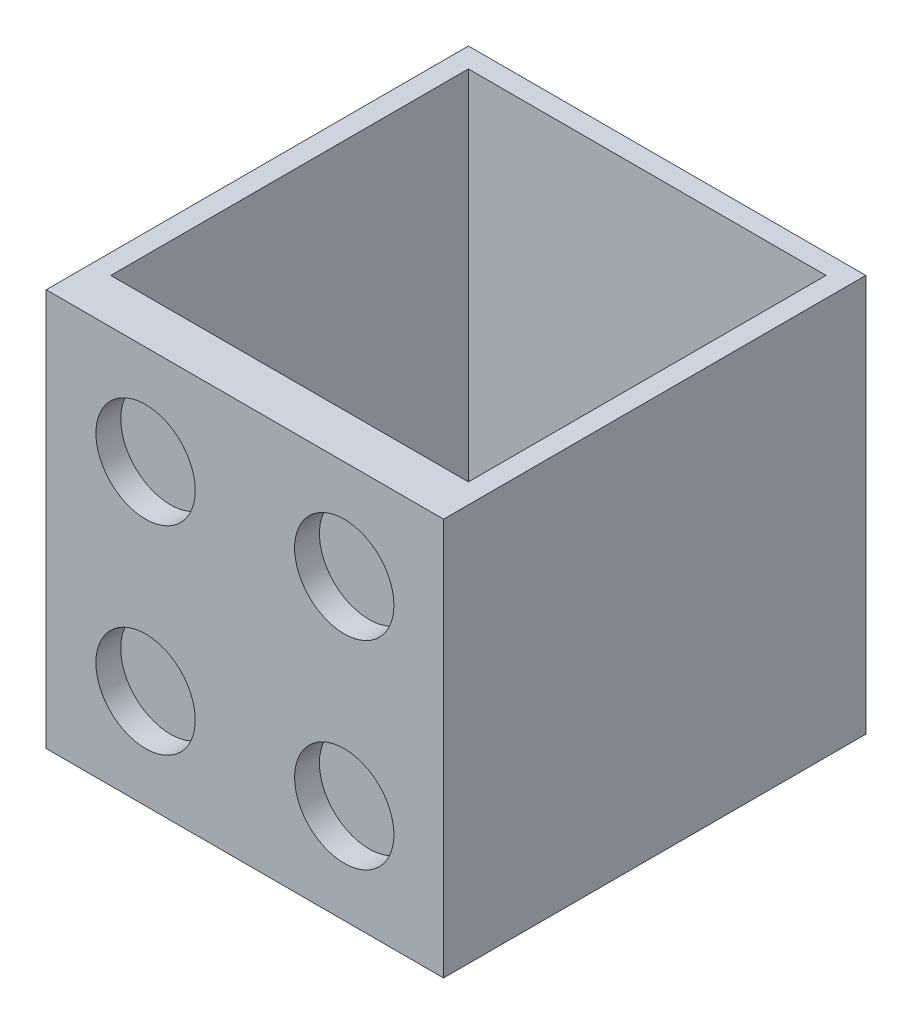
from build123d import *

# Parameters (mm, degrees)
SKETCH1_W           = 50.8
SKETCH1_H           = 50.8
BOSS_EXTRUDE1_DEPTH = 53.975
SKETCH3_R           = 6.35
SKETCH3_R_2         = 2.54
CUT_EXTRUDE2_DEPTH  = 3.175
SKETCH4_W           = 45.72
SKETCH4_H           = 45.72
CUT_EXTRUDE3_DEPTH  = 48.26


with BuildPart() as part:
    # Sketch1 → Boss-Extrude1 (new body)
    with BuildSketch(Plane.XY):
        with Locations((25.4, 25.4)):
            Rectangle(SKETCH1_W, SKETCH1_H)
    extrude(amount=BOSS_EXTRUDE1_DEPTH)

    # Sketch3 → Cut-Extrude2 (cut)
    with BuildSketch(Plane.XY.offset(53.975)):
        with Locations((12.7, 139.7)):
            Circle(SKETCH3_R)
        with Locations((38.1, 139.7)):
            Circle(SKETCH3_R)
        with Locations((63.5, 139.7)):
            Circle(SKETCH3_R_2)
        with Locations((88.9, 139.7)):
            Circle(SKETCH3_R_2)
        with Locations((88.9, 114.3)):
            Circle(SKETCH3_R_2)
        with Locations((63.5, 114.3)):
            Circle(SKETCH3_R_2)
        with Locations((38.1, 114.3)):
            Circle(SKETCH3_R)
        with Locations((12.7, 114.3)):
            Circle(SKETCH3_R)
        with Locations((88.9, 88.9)):
            Circle(SKETCH3_R_2)
        with Locations((63.5, 88.9)):
            Circle(SKETCH3_R_2)
        with Locations((38.1, 88.9)):
            Circle(SKETCH3_R)
        with Locations((12.7, 88.9)):
            Circle(SKETCH3_R)
        with Locations((88.9, 63.5)):
            Circle(SKETCH3_R_2)
        with Locations((63.5, 63.5)):
            Circle(SKETCH3_R_2)
        with Locations((38.1, 63.5)):
            Circle(SKETCH3_R)
        with Locations((12.7, 63.5)):
            Circle(SKETCH3_R)
        with Locations((88.9, 38.1)):
            Circle(SKETCH3_R_2)
        with Locations((63.5, 38.1)):
            Circle(SKETCH3_R_2)
        with Locations((38.1, 38.1)):
            Circle(SKETCH3_R)
        with Locations((12.7, 38.1)):
            Circle(SKETCH3_R)
        with Locations((88.9, 12.7)):
            Circle(SKETCH3_R_2)
        with Locations((63.5, 12.7)):
            Circle(SKETCH3_R_2)
        with Locations((38.1, 12.7)):
            Circle(SKETCH3_R)
        with Locations((12.7, 12.7)):
            Circle(SKETCH3_R)
    extrude(amount=-CUT_EXTRUDE2_DEPTH, mode=Mode.SUBTRACT)

    # Sketch4 → Cut-Extrude3 (cut)
    with BuildSketch(Plane(origin=(0, 50.8, 0), x_dir=(1, 0, 0), z_dir=(0, 1, 0))):
        with Locations((25.4, -25.4)):
            Rectangle(SKETCH4_W, SKETCH4_H)
    extrude(amount=-CUT_EXTRUDE3_DEPTH, mode=Mode.SUBTRACT)


solid = part.part
